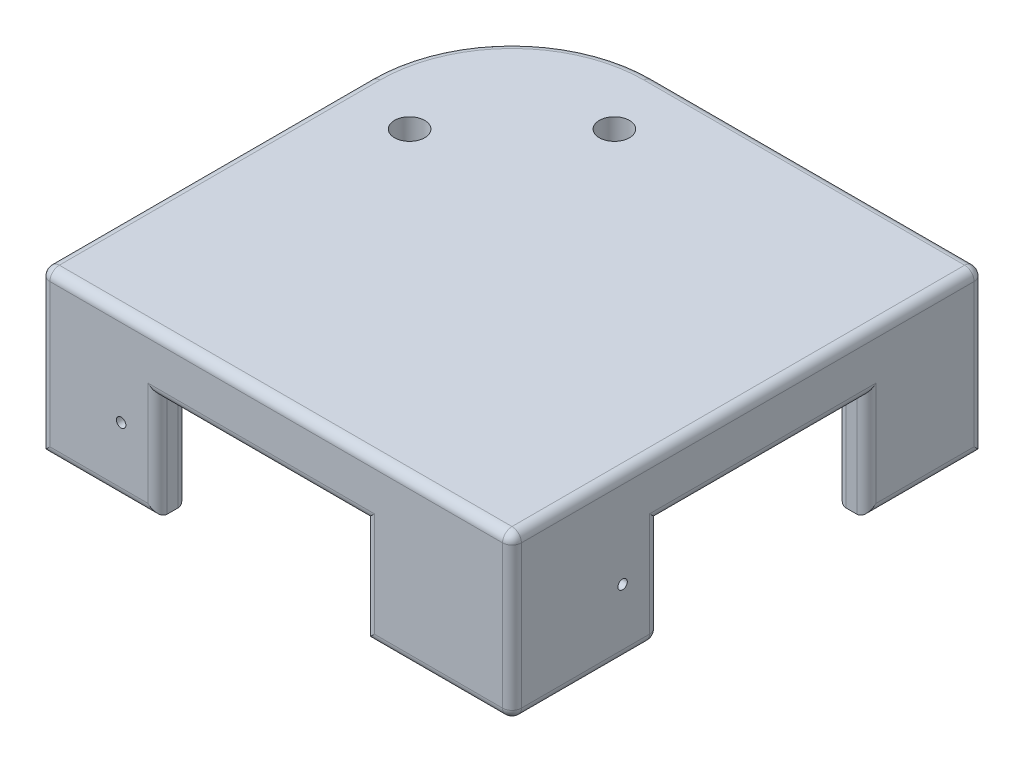
from build123d import *

# Parameters (mm, degrees)
SKETCH1_W           = 50
SKETCH1_H           = 50
BOSS_EXTRUDE1_DEPTH = 3.175
SKETCH2_W           = 3.175
SKETCH2_H           = 46.825
BOSS_EXTRUDE2_DEPTH = 14
SKETCH3_W           = 22
SKETCH3_H           = 8.1
SKETCH3_H_2         = 2.95
SKETCH3_R           = 0.5
CUT_EXTRUDE1_DEPTH  = 55.896089342
SKETCH4_W           = 22
SKETCH4_H           = 8.1
SKETCH4_H_2         = 2.95
SKETCH4_R           = 0.5
CUT_EXTRUDE2_DEPTH  = 55.896089342
SKETCH5_R           = 1.6
CUT_EXTRUDE3_DEPTH  = 40.306241553
FILLET1_R           = 1
FILLET2_R           = 15


with BuildPart() as part:
    # Sketch1 → Boss-Extrude1 (new body)
    with BuildSketch(Plane(origin=(0, 0, 0), x_dir=(1, 0, 0), z_dir=(0, 1, 0))):
        Rectangle(SKETCH1_W, SKETCH1_H)
    extrude(amount=BOSS_EXTRUDE1_DEPTH)

    # Sketch2 → Boss-Extrude2 (add)
    with BuildSketch(Plane(origin=(0, 0, 0), x_dir=(-1, 0, 0), z_dir=(0, -1, 0))):
        Polygon((-25, -25), (25, -25), (25, -21.825), (-21.825, -21.825), (-25, -21.825), align=None)
        with Locations((-23.4125, 1.5875)):
            Rectangle(SKETCH2_W, SKETCH2_H)
    extrude(amount=BOSS_EXTRUDE2_DEPTH)

    # Sketch3 → Cut-Extrude1 (cut, through all)
    with BuildSketch(Plane(origin=(0, 0, 21.825), x_dir=(-1, 0, 0), z_dir=(0, 0, -1))):
        with Locations((1.5875, -7)):
            Rectangle(SKETCH3_W, SKETCH3_H)
        with Locations((1.5875, -12.525)):
            Rectangle(SKETCH3_W, SKETCH3_H_2)
        with Locations((16.4475, -7)):
            Circle(SKETCH3_R)
    extrude(amount=-CUT_EXTRUDE1_DEPTH, mode=Mode.SUBTRACT)

    # Sketch4 → Cut-Extrude2 (cut, through all)
    with BuildSketch(Plane.ZY.offset(-21.825)):
        with Locations((-1.5875, -7)):
            Rectangle(SKETCH4_W, SKETCH4_H)
        with Locations((-1.5875, -12.525)):
            Rectangle(SKETCH4_W, SKETCH4_H_2)
        with Locations((13.2725, -7)):
            Circle(SKETCH4_R)
    extrude(amount=-CUT_EXTRUDE2_DEPTH, mode=Mode.SUBTRACT)

    # Sketch5 → Cut-Extrude3 (cut, through all)
    with BuildSketch(Plane(origin=(0, 3.175, 0), x_dir=(1, 0, 0), z_dir=(0, 1, 0))):
        with Locations(Location((-7.071067812, 17.928932188, 0), (0, 0, 270))):
            Circle(SKETCH5_R)
        with Locations(Location((-17.928932188, 7.071067812, 0), (0, 0, 270))):
            Circle(SKETCH5_R)
    extrude(amount=-CUT_EXTRUDE3_DEPTH, mode=Mode.SUBTRACT)

    # Fillet1
    fillet1_edges = [part.edges().sort_by_distance(p)[0] for p in [
        (-25, 3.175, 0),
        (0, 3.175, 25),
        (-1.5875, 0, -25),
        (-1.5875, 0, 21.825),
        (-25, -7, 21.825),
        (21.825, -14, -18.79375),
        (21.825, -7, -25),
        (-18.79375, -14, 21.825),
        (25, -14, -18.79375),
        (17.20625, -14, 25),
        (21.825, 0, -1.5875),
        (15.61875, -14, 21.825),
        (-18.79375, -14, 25),
        (25, 3.175, 0),
        (9.4125, -8.475, 21.825),
        (-1.5875, -2.95, 25),
        (-12.5875, -8.475, 25),
        (9.4125, -8.475, 25),
        (-12.5875, -8.475, 21.825),
        (-1.5875, -2.95, 21.825),
        (-25, 0, -1.5875),
        (21.825, -14, 15.61875),
        (25, -14, 17.20625),
        (21.825, -8.475, -12.5875),
        (25, -2.95, -1.5875),
        (25, -8.475, 9.4125),
        (23.4125, -14, 9.4125),
        (25, -8.475, -12.5875),
        (21.825, -8.475, 9.4125),
        (21.825, -2.95, -1.5875),
        (0, 3.175, -25),
        (25, -5.4125, 25),
        (-25, -5.4125, 25),
        (25, -5.4125, -25),
    ]]
    fillet(fillet1_edges, radius=FILLET1_R)

    # Fillet2
    # the kernel refuses this fillet: 15 mm, written as the material it takes off along each edge
    with BuildSketch(Plane(origin=(-10, 3.175, -10), x_dir=(0, 0, -1), z_dir=(1, 0, 0))) as fillet2_piece_1:
        with BuildLine():
            CenterArc((14, -1), 1, 0, 90)
            Line((15, -1), (15, 0))
            Line((15, 0), (14, 0))
        make_face()
    revolve(axis=Axis((-10, 3.175, -10), (0, 1, 0)), revolution_arc=90, mode=Mode.SUBTRACT)
    with BuildSketch(Plane(origin=(-10, 0, -10), x_dir=(-1, 0, 0), z_dir=(0, 0, 1))) as fillet2_piece_2:
        with BuildLine():
            CenterArc((14, -1), 1, 0, 90)
            Line((15, -1), (15, 0))
            Line((15, 0), (14, 0))
        make_face()
    revolve(axis=Axis((-10, 0, -10), (0, -1, 0)), revolution_arc=90, mode=Mode.SUBTRACT)
    with BuildSketch(Plane(origin=(-25, 0, -25), x_dir=(1, 0, 0), z_dir=(0, 1, 0))) as fillet2_piece_3:
        with BuildLine():
            CenterArc((FILLET2_R, -FILLET2_R), FILLET2_R, 90, 90)
            Line((0, -FILLET2_R), (0, 0))
            Line((0, 0), (FILLET2_R, 0))
        make_face()
    extrude(amount=3.175, mode=Mode.SUBTRACT)


solid = part.part
